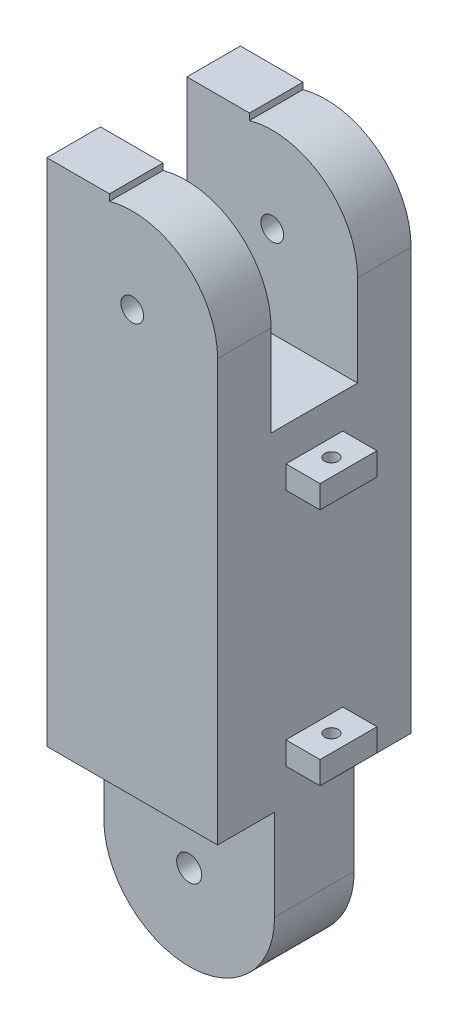
from build123d import *

# Parameters (mm, degrees)
LINK1_BODY_DEPTH       = 8.5
TONGUE_CUT_DEPTH       = 56.258483512
TONGUE_CUT_DEPTH_BACK  = 56.258483512
SKETCH1_W              = 5.5
SKETCH1_H              = 15.998130079
SKETCH7_W              = 5.5
SKETCH7_H              = 7.8
BOSS_EXTRUDE1_DEPTH    = 8.5
SLOT_CUT_DEPTH         = 55.003148056
SLOT_CUT_DEPTH_BACK    = 55.003148056
SKETCH2_W              = 7.6
SKETCH2_H              = 18
PIN_HOLES_DEPTH        = 55.003148056
PIN_HOLES_DEPTH_BACK   = 55.003148056
SKETCH3_R              = 1.1
SKETCH3_R_2            = 1
SKETCH4_W              = 3.5
SKETCH4_H              = 2
GUIDE_BLOCK_1_DEPTH    = 2.5
SKETCH5_W              = 3.5
SKETCH5_H              = 2
GUIDE_BLOCK_2_DEPTH    = 2.5
CORD_GUIDES_DEPTH      = 55.500938464
CORD_GUIDES_DEPTH_BACK = 55.500938464
SKETCH6_R              = 0.6


with BuildPart() as part:
    # Link1_Outline → Link1_Body (new, symmetric)
    with BuildSketch(Plane.XY):
        with BuildLine():
            Line((-7.5, 0), (-7.5, 45))
            ThreePointArc((-7.5, 45), (0, 52.5), (7.5, 45))
            Line((7.5, 45), (7.5, 0))
            ThreePointArc((7.5, 0), (0, -7.5), (-7.5, 0))
        make_face()
    extrude(amount=LINK1_BODY_DEPTH, both=True)

    # Sketch1 → Tongue_Cut (cut, two sides: drawn at the far end of the back side and taken through both)
    with BuildSketch(Plane(origin=(7.5, 0, 0), x_dir=(0, 0, -1), z_dir=(1, 0, 0)).offset(-TONGUE_CUT_DEPTH_BACK)):
        with Locations((6.25, -0.00093496)):
            Rectangle(SKETCH1_W, SKETCH1_H)
        with Locations((-6.25, -0.00093496)):
            Rectangle(SKETCH1_W, SKETCH1_H)
    extrude(amount=TONGUE_CUT_DEPTH + TONGUE_CUT_DEPTH_BACK, mode=Mode.SUBTRACT)

    # Sketch7 → Boss-Extrude1 (add, symmetric)
    with BuildSketch(Plane.XY):
        with Locations((-4.75, 48.9)):
            Rectangle(SKETCH7_W, SKETCH7_H)
    extrude(amount=BOSS_EXTRUDE1_DEPTH, both=True)

    # Sketch2 → Slot_Cut (cut, two sides: drawn at the far end of the back side and taken through both)
    with BuildSketch(Plane(origin=(0, 0, 0), x_dir=(0, 0, -1), z_dir=(1, 0, 0)).offset(-SLOT_CUT_DEPTH_BACK)):
        with Locations((0, 46)):
            Rectangle(SKETCH2_W, SKETCH2_H)
    extrude(amount=SLOT_CUT_DEPTH + SLOT_CUT_DEPTH_BACK, mode=Mode.SUBTRACT)

    # Sketch3 → Pin_Holes (cut, two sides: drawn at the far end of the back side and taken through both)
    with BuildSketch(Plane.XY.offset(-PIN_HOLES_DEPTH_BACK)):
        Circle(SKETCH3_R)
        with Locations((0, 45)):
            Circle(SKETCH3_R_2)
    extrude(amount=PIN_HOLES_DEPTH + PIN_HOLES_DEPTH_BACK, mode=Mode.SUBTRACT)

    # Sketch4 → Guide_Block_1 (add, symmetric)
    with BuildSketch(Plane.XY):
        with Locations((8.75, 12)):
            Rectangle(SKETCH4_W, SKETCH4_H)
    extrude(amount=GUIDE_BLOCK_1_DEPTH, both=True)

    # Sketch5 → Guide_Block_2 (add, symmetric)
    with BuildSketch(Plane.XY):
        with Locations((8.750585387, 33)):
            Rectangle(SKETCH5_W, SKETCH5_H)
    extrude(amount=GUIDE_BLOCK_2_DEPTH, both=True)

    # Sketch6 → Cord_Guides (cut, two sides: drawn at the far end of the back side and taken through both)
    with BuildSketch(Plane(origin=(0, 0, 0), x_dir=(1, 0, 0), z_dir=(0, 1, 0)).offset(-CORD_GUIDES_DEPTH_BACK)):
        with Locations((9, 0)):
            Circle(SKETCH6_R)
    extrude(amount=CORD_GUIDES_DEPTH + CORD_GUIDES_DEPTH_BACK, mode=Mode.SUBTRACT)


solid = part.part
